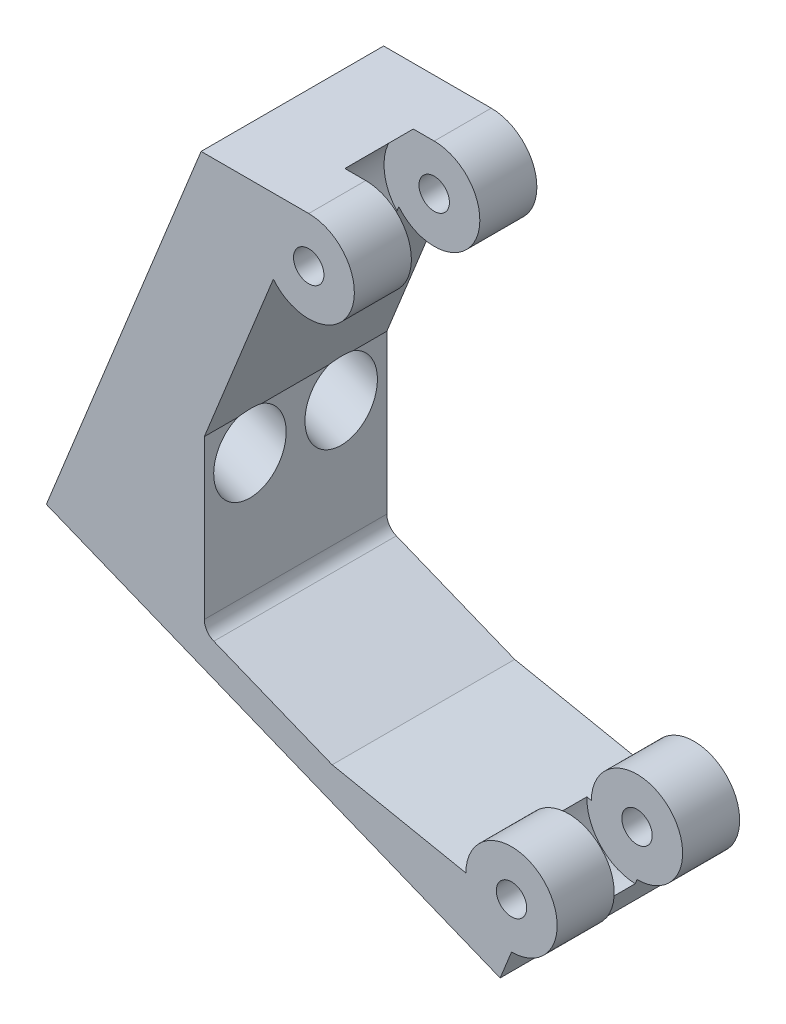
from build123d import *

# Parameters (mm, degrees)
SKETCH1_R                     = 1
BOSS_EXTRUDE1_DEPTH           = 12
CUT_EXTRUDE1_DEPTH            = 2.25
CUT_EXTRUDE1_DEPTH_BACK       = 2.25
SKETCH2_R                     = 3.3
FILLET3_R                     = 1
BOSS_EXTRUDE2_REACH           = 51.61
SKETCH4_W                     = 12
SKETCH4_H                     = 26.489515
SCREW_SHAFT_HOLES_DEPTH       = 42.118659
SCREW_SHAFT_HOLES_DEPTH_BACK  = 42.118659
HOLE_SKETCH_R                 = 1.288406
SCREW_COUNTERBORES_DEPTH      = 5
SCREW_COUNTERBORES_DEPTH_BACK = 2.591837
SKETCH5_R                     = 2.38125
SKETCH6_W                     = 18.725224
SKETCH6_H                     = 35.053619
CUT_EXTRUDE2_DEPTH            = 1.66


with BuildPart() as part:
    # Sketch1 → Boss-Extrude1 (new body)
    with BuildSketch(Plane.XY):
        with BuildLine():
            Line((0, 6.64067), (0, 35.210533))
            Line((0, 35.210533), (8.86544, 35.210533))
            ThreePointArc((8.86544, 35.210533), (11.575609, 30.924071), (6.541088, 30.313855))
            Line((6.541088, 30.313855), (2, 19.074268))
            Line((2, 19.074268), (2, 7.989687))
            Line((2, 7.989687), (10.406939, 4.593064))
            Line((10.406939, 4.593064), (19.199233, 2.828667))
            ThreePointArc((19.199233, 2.828667), (24.320553, 4.949988), (22.199233, -0.171333))
            Line((22.199233, -0.171333), (21.45002, -2.0257))
            Line((21.45002, -2.0257), (0, 6.64067))
        make_face()
        with Locations((8.86544, 32.210533)):
            Circle(SKETCH1_R, mode=Mode.SUBTRACT)
        with Locations((22.199233, 2.828667)):
            Circle(SKETCH1_R, mode=Mode.SUBTRACT)
    extrude(amount=BOSS_EXTRUDE1_DEPTH)

    # Sketch2 → Cut-Extrude1 (cut, two sides: drawn at the far end of the back side and taken through both)
    with BuildSketch(Plane.XY.offset(6).offset(-CUT_EXTRUDE1_DEPTH_BACK)):
        with Locations((8.86544, 32.210533)):
            Circle(SKETCH2_R)
        with Locations((22.199233, 2.828667)):
            Circle(SKETCH2_R)
    extrude(amount=CUT_EXTRUDE1_DEPTH + CUT_EXTRUDE1_DEPTH_BACK, mode=Mode.SUBTRACT)

    # Fillet3
    fillet3_edges = [part.edges().sort_by_distance(p)[0] for p in [
        (2, 7.989687, 6),
    ]]
    fillet(fillet3_edges, radius=FILLET3_R)

    # Boss-Extrude2: up to this face of the body (flat: up to its plane)
    boss_extrude2_end = Plane(part.part.faces().sort_by_distance((0, 20.925601, 6))[0])
    # Sketch4 → Boss-Extrude2 (add, up to the picked face)
    with BuildSketch(Plane(origin=(-12.229646, 4.941098, 0), x_dir=(0, 0, -1), z_dir=(-0.9271838545667871, 0.37460659341591285, 0)), mode=Mode.PRIVATE) as boss_extrude2_sk1:
        with Locations((-6, -19.401879)):
            Rectangle(SKETCH4_W, SKETCH4_H)
    boss_extrude2_tool1 = split(extrude(boss_extrude2_sk1.sketch, amount=-BOSS_EXTRUDE2_REACH, mode=Mode.PRIVATE), bisect_by=boss_extrude2_end, keep=Keep.BOTH, mode=Mode.PRIVATE)
    add(boss_extrude2_tool1.solids().sort_by(Axis((-4.961574, 22.930207, 6), (0.9271838545667871, -0.37460659341591285, 0)))[0])

    # Hole sketch → Screw shaft holes (cut, two sides: drawn at the far end of the back side and taken through both)
    with BuildSketch(Plane(origin=(7.683612, 33.141702, 0), x_dir=(0, 0, -1), z_dir=(-0.927183854566786, 0.3746065934159158, 0)).offset(-SCREW_SHAFT_HOLES_DEPTH_BACK)):
        with Locations((-9, 17.420162)):
            Circle(HOLE_SKETCH_R)
        with Locations((-3, 17.420162)):
            Circle(HOLE_SKETCH_R)
        with Locations((-6, 6.887654)):
            Circle(HOLE_SKETCH_R)
    extrude(amount=SCREW_SHAFT_HOLES_DEPTH + SCREW_SHAFT_HOLES_DEPTH_BACK, mode=Mode.SUBTRACT)

    # Sketch5 → Screw counterbores (cut, two sides: drawn at the far end of the back side and taken through both)
    with BuildSketch(Plane(origin=(-4.90571, 1.982036, 0), x_dir=(0, 0, -1), z_dir=(0.927183854566786, -0.3746065934159158, 0)).offset(-SCREW_COUNTERBORES_DEPTH_BACK)):
        with Locations((-6, 26.719128)):
            Circle(SKETCH5_R)
        with Locations((-9, 16.18662)):
            Circle(SKETCH5_R)
        with Locations((-3, 16.18662)):
            Circle(SKETCH5_R)
    extrude(amount=SCREW_COUNTERBORES_DEPTH + SCREW_COUNTERBORES_DEPTH_BACK, mode=Mode.SUBTRACT)

    # Sketch6 → Cut-Extrude2 (cut)
    with BuildSketch(Plane(origin=(-12.229646, 4.941098, 0), x_dir=(0, 0, 1), z_dir=(-0.9271838545667871, 0.37460659341591296, 0))):
        with Locations((5.96255, 20.221942)):
            Rectangle(SKETCH6_W, SKETCH6_H)
    extrude(amount=-CUT_EXTRUDE2_DEPTH, mode=Mode.SUBTRACT)


solid = part.part
